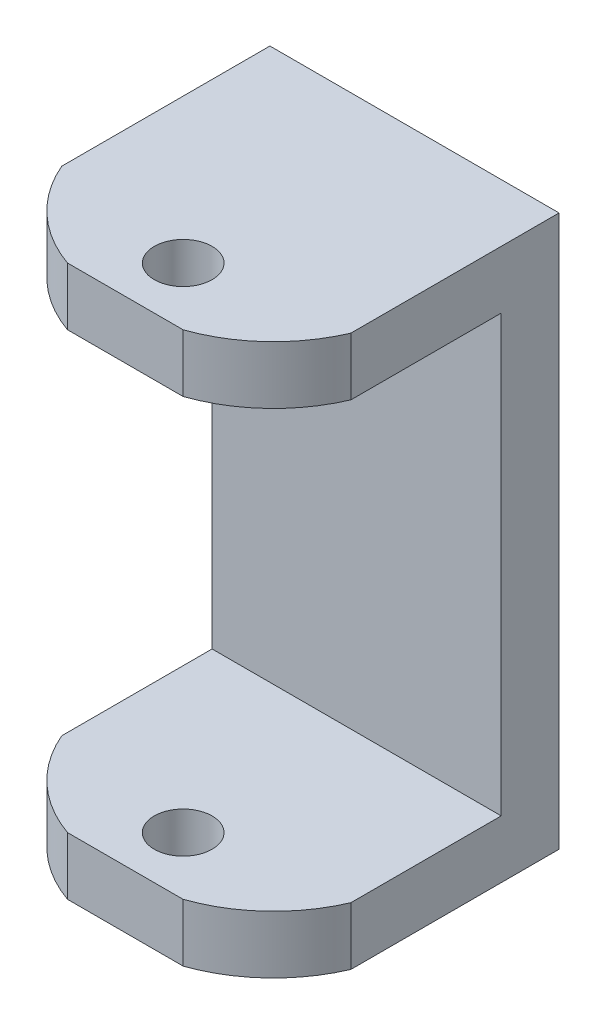
from build123d import *

# Parameters (mm, degrees)
SKETCH1_R           = 2.5
BOSS_EXTRUDE1_DEPTH = 47.65
SKETCH2_W           = 20
SKETCH2_H           = 37.65
CUT_EXTRUDE1_DEPTH  = 60.333991101


with BuildPart() as part:
    # Sketch1 → Boss-Extrude1 (new body)
    with BuildSketch(Plane(origin=(0, 0, 0), x_dir=(1, 0, 0), z_dir=(0, 1, 0))):
        with BuildLine():
            Line((-5, 0), (5, 0))
            ThreePointArc((5, 0), (9.487755282, 2.709547912), (12.5, 7))
            Line((12.5, 7), (12.5, 25))
            Line((12.5, 25), (-12.5, 25))
            Line((-12.5, 25), (-12.5, 7))
            ThreePointArc((-12.5, 7), (-9.487755282, 2.709547912), (-5, 0))
        make_face()
        with Locations((0, 5)):
            Circle(SKETCH1_R, mode=Mode.SUBTRACT)
    extrude(amount=BOSS_EXTRUDE1_DEPTH)

    # Sketch2 → Cut-Extrude1 (cut, through all)
    with BuildSketch(Plane.ZY.offset(12.5)):
        with Locations((-10, 23.825)):
            Rectangle(SKETCH2_W, SKETCH2_H)
    extrude(amount=-CUT_EXTRUDE1_DEPTH, mode=Mode.SUBTRACT)


solid = part.part
